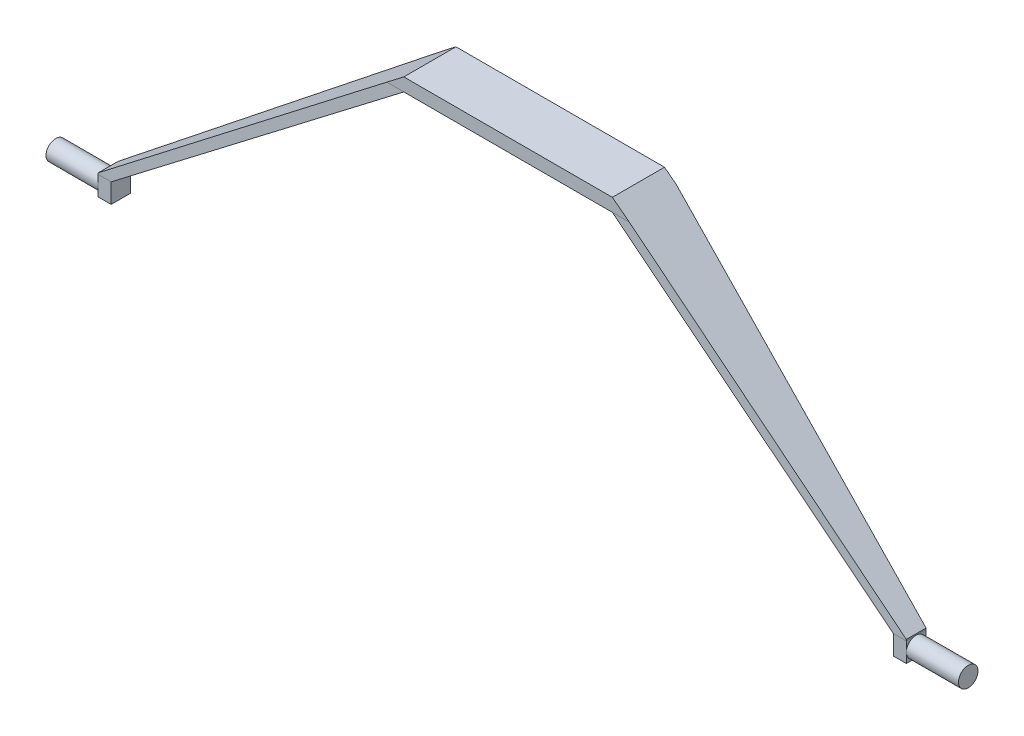
from build123d import *

# Parameters (mm, degrees)
BOSS_EXTRUDE1_DEPTH            = 11.43
BOSS_EXTRUDE1_DEPTH_BACK       = 101.6
SKETCH2_R                      = 19.05
BOSS_EXTRUDE2_DEPTH            = 101.6
CUT_EXTRUDE2_REACH             = 930.494
CUT_EXTRUDE2_DIRECTION_2_REACH = 930.494
CUT_EXTRUDE3_REACH             = 930.494
CUT_EXTRUDE3_DIRECTION_2_REACH = 930.494


with BuildPart() as part:
    # Sketch1 → Boss-Extrude1 (new, two sides: drawn at the far end of the back side and taken through both)
    with BuildSketch(Plane.XY.offset(-BOSS_EXTRUDE1_DEPTH_BACK)):
        Polygon((-787.4, -209.55), (-787.471663752, -247.65), (-762.071663752, -247.65), (-762.071663752, -209.55), (-203.2, 215.9), (203.2, 215.9), (762.071663752, -209.55), (762.071663752, -247.65), (787.471663752, -247.65), (787.4, -209.55), (787.4, -207.01), (203.2, 241.3), (-203.2, 241.3), (-787.4, -207.01), align=None)
    extrude(amount=BOSS_EXTRUDE1_DEPTH + BOSS_EXTRUDE1_DEPTH_BACK)

    # Sketch2 → Boss-Extrude2 (add)
    with BuildSketch(Plane(origin=(-787.003065002, 1.480304267, 0), x_dir=(0, 0, 1), z_dir=(-0.9999982310401075, 0.0018809350483380617, 0))):
        with Locations((-7.62, -230.080744969)):
            Circle(SKETCH2_R)
    boss_extrude2 = extrude(amount=BOSS_EXTRUDE2_DEPTH)

    # Mirror1: Boss-Extrude2 across plane
    add(boss_extrude2.mirror(Plane(origin=(0, 0, 0), x_dir=(0, 0, 1), z_dir=(1, 0, 0))))

    # Sketch5 → Cut-Extrude2 (cut, up to next)
    with BuildSketch(Plane(origin=(0, 0, 0), x_dir=(0, 0, -1), z_dir=(1, 0, 0)), mode=Mode.PRIVATE) as cut_extrude2_sk1:
        Polygon((-11.43, -209.55), (0, 215.9), (0, 241.3), (-11.43, 241.3), (-11.43, 215.9), align=None)
    cut_extrude2_tool1 = extrude(cut_extrude2_sk1.sketch, amount=-CUT_EXTRUDE2_REACH, mode=Mode.PRIVATE) & part.part
    add(cut_extrude2_tool1.solids().sort_by_distance((0, 90.565111, 7.4168))[0], mode=Mode.SUBTRACT)

    # Sketch5 → Cut-Extrude2 direction 2 (cut, up to next)
    with BuildSketch(Plane(origin=(0, 0, 0), x_dir=(0, 0, -1), z_dir=(1, 0, 0)), mode=Mode.PRIVATE) as cut_extrude2_direction_2_sk1:
        Polygon((-11.43, -209.55), (0, 215.9), (0, 241.3), (-11.43, 241.3), (-11.43, 215.9), align=None)
    cut_extrude2_direction_2_tool1 = extrude(cut_extrude2_direction_2_sk1.sketch, amount=CUT_EXTRUDE2_DIRECTION_2_REACH, mode=Mode.PRIVATE) & part.part
    add(cut_extrude2_direction_2_tool1.solids().sort_by_distance((0, 90.565111, 7.4168))[0], mode=Mode.SUBTRACT)

    # Sketch7 → Cut-Extrude3 (cut, up to next)
    with BuildSketch(Plane(origin=(0, 0, 0), x_dir=(0, 0, -1), z_dir=(1, 0, 0)), mode=Mode.PRIVATE) as cut_extrude3_sk1:
        Polygon((26.67, -209.55), (101.6, 223.982414479), (101.6, -247.65), (26.67, -247.65), align=None)
    cut_extrude3_tool1 = extrude(cut_extrude3_sk1.sketch, amount=-CUT_EXTRUDE3_REACH, mode=Mode.PRIVATE) & part.part
    add(cut_extrude3_tool1.solids().sort_by_distance((0, -89.489932, -74.75645))[0], mode=Mode.SUBTRACT)

    # Sketch7 → Cut-Extrude3 direction 2 (cut, up to next)
    with BuildSketch(Plane(origin=(0, 0, 0), x_dir=(0, 0, -1), z_dir=(1, 0, 0)), mode=Mode.PRIVATE) as cut_extrude3_direction_2_sk1:
        Polygon((26.67, -209.55), (101.6, 223.982414479), (101.6, -247.65), (26.67, -247.65), align=None)
    cut_extrude3_direction_2_tool1 = extrude(cut_extrude3_direction_2_sk1.sketch, amount=CUT_EXTRUDE3_DIRECTION_2_REACH, mode=Mode.PRIVATE) & part.part
    add(cut_extrude3_direction_2_tool1.solids().sort_by_distance((0, -89.489932, -74.75645))[0], mode=Mode.SUBTRACT)


solid = part.part
